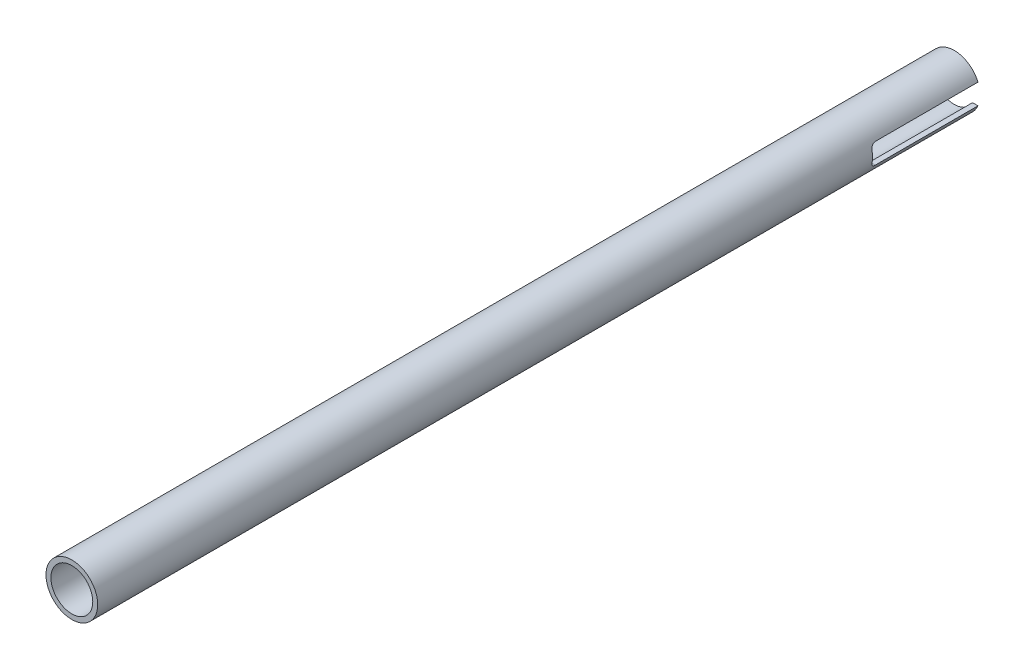
from build123d import *

# Parameters (mm, degrees)
SKETCH1_R               = 8.001
SKETCH1_R_2             = 6.477
BOSS_EXTRUDE1_DEPTH     = 273.05
CUT_EXTRUDE1_DEPTH      = 274.284347342
CUT_EXTRUDE1_DEPTH_BACK = 274.284347342


with BuildPart() as part:
    # Sketch1 → Boss-Extrude1 (new body)
    with BuildSketch(Plane.XY):
        Circle(SKETCH1_R)
        Circle(SKETCH1_R_2, mode=Mode.SUBTRACT)
    extrude(amount=BOSS_EXTRUDE1_DEPTH)

    # Sketch2 → Cut-Extrude1 (cut, two sides: drawn at the far end of the back side and taken through both)
    with BuildSketch(Plane(origin=(0, 0, 0), x_dir=(0, 0, -1), z_dir=(1, 0, 0)).offset(-CUT_EXTRUDE1_DEPTH_BACK)):
        with BuildLine():
            Line((556.557244855, 3.175), (0, 3.175))
            Line((0, 3.175), (-31.75, 3.175))
            ThreePointArc((-31.75, 3.175), (-32.827630735, 2.728630735), (-33.274, 1.651))
            Line((-33.274, 1.651), (-33.274, -1.651))
            ThreePointArc((-33.274, -1.651), (-32.827630735, -2.728630735), (-31.75, -3.175))
            Line((-31.75, -3.175), (0, -3.175))
            Line((0, -3.175), (556.557244855, -3.175))
            Line((556.557244855, -3.175), (1669.671734566, -3.175))
            Line((1669.671734566, -3.175), (1669.671734566, 3.175))
            Line((1669.671734566, 3.175), (556.557244855, 3.175))
        make_face()
    extrude(amount=CUT_EXTRUDE1_DEPTH + CUT_EXTRUDE1_DEPTH_BACK, mode=Mode.SUBTRACT)


solid = part.part
